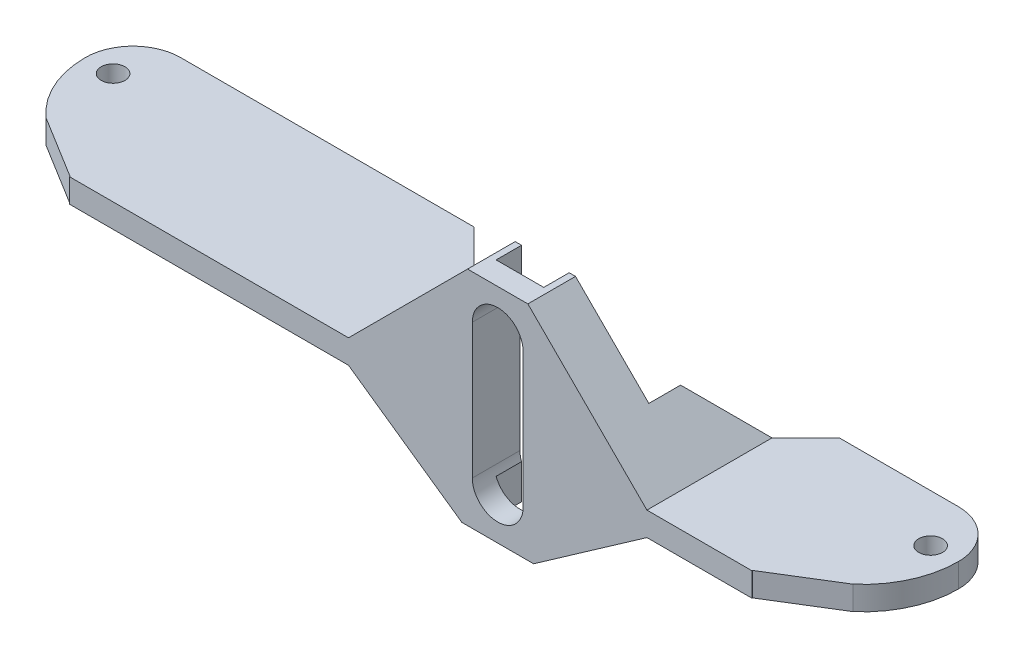
from build123d import *
from build123d.topology import SkipClean

# Parameters (mm, degrees)
BOSS_EXTRUDE1_DEPTH = 3
CUT_EXTRUDE1_DEPTH  = 10
CUT_EXTRUDE3_START  = 8
SKETCH8_W           = 6
SKETCH8_H           = 3
CUT_EXTRUDE3_DEPTH  = 6
BOSS_EXTRUDE4_START = 18
BOSS_EXTRUDE4_DEPTH = 28
BOSS_EXTRUDE5_DEPTH = 3
CUT_EXTRUDE4_DEPTH  = 3
CHAMFER1_SIZE       = 15
CHAMFER2_SIZE       = 15
CHAMFER2_SIZE_2     = 10.503113073
CUT_EXTRUDE5_DEPTH  = 10
CUT_EXTRUDE6_DEPTH  = 5
BOSS_EXTRUDE8_DEPTH = 2
CHAMFER3_DEPTH      = 4
CHAMFER3_2_DEPTH    = 3


with BuildPart() as part:
    # Sketch1 → Boss-Extrude1 (new body)
    with BuildSketch(Plane(origin=(0, 0, 0), x_dir=(1, 0, 0), z_dir=(0, 1, 0))):
        with BuildLine():
            ThreePointArc((-49, -6), (-53.242640687, -4.242640687), (-55, 0))
            ThreePointArc((-55, 0), (-51.485281374, -8.485281374), (-43, -12))
            Line((-43, -12), (43, -12))
            ThreePointArc((43, -12), (51.485281374, -8.485281374), (55, 0))
            ThreePointArc((55, 0), (53.242640687, -4.242640687), (49, -6))
            Line((49, -6), (-49, -6))
        make_face()
        with BuildLine():
            Line((-53, 0), (-55, 0))
            ThreePointArc((-55, 0), (-53.242640687, -4.242640687), (-49, -6))
            Line((-49, -6), (49, -6))
            ThreePointArc((49, -6), (53.242640687, -4.242640687), (55, 0))
            Line((55, 0), (53, 0))
            ThreePointArc((53, 0), (51.5, -1.5), (50, 0))
            Line((50, 0), (-50, 0))
            ThreePointArc((-50, 0), (-51.5, -1.5), (-53, 0))
        make_face()
        with BuildLine():
            Line((49, 6), (-49, 6))
            ThreePointArc((-49, 6), (-53.242640687, 4.242640687), (-55, 0))
            Line((-55, 0), (-53, 0))
            ThreePointArc((-53, 0), (-51.5, 1.5), (-50, 0))
            Line((-50, 0), (50, 0))
            ThreePointArc((50, 0), (51.5, 1.5), (53, 0))
            Line((53, 0), (55, 0))
            ThreePointArc((55, 0), (53.242640687, 4.242640687), (49, 6))
        make_face()
    extrude(amount=BOSS_EXTRUDE1_DEPTH)

    # Sketch2 → Cut-Extrude1 (cut)
    with BuildSketch(Plane(origin=(0, 3, 0), x_dir=(1, 0, 0), z_dir=(0, 1, 0))):
        Polygon((22, -8), (36, 6), (-14, 6), (0, -8), align=None)
    extrude(amount=-CUT_EXTRUDE1_DEPTH, mode=Mode.SUBTRACT)

    # Sketch8 → Cut-Extrude3 (cut)
    with BuildSketch(Plane.XY.offset(CUT_EXTRUDE3_START)):
        with Locations((10.960071178, 1.5)):
            Rectangle(SKETCH8_W, SKETCH8_H)
    extrude(amount=CUT_EXTRUDE3_DEPTH, mode=Mode.SUBTRACT)


with BuildPart() as cut_extrude3_piece_1:
    # of the separate pieces the step leaves, piece 1, a body of its own (cut_extrude3_pieces)
    add(part.part.solids().sort_by_distance((-55, 0, 0))[0])

    # Sketch9 → Boss-Extrude4 (add)
    with BuildSketch(Plane(origin=(0, 0, 0), x_dir=(1, 0, 0), z_dir=(0, 1, 0)).offset(BOSS_EXTRUDE4_START)):
        Polygon((13.960071178, -11.2), (13.960071178, -8), (14.760071178, -8), (14.760071178, -12), (7.160071178, -12), (7.160071178, -8), (7.960071178, -8), (7.960071178, -11.2), align=None)
    extrude(amount=-BOSS_EXTRUDE4_DEPTH)


with BuildPart() as cut_extrude3_piece_2:
    # of the separate pieces the step leaves, piece 2, a body of its own (cut_extrude3_pieces)
    add(part.part.solids().sort_by_distance((13.960071178, 0, 12))[0])


with BuildPart() as cut_extrude3_piece_1_1:
    add(cut_extrude3_piece_1.part)

    # Combine1: union Cut-Extrude3 piece 2
    add(cut_extrude3_piece_2.part)

    # Sketch11 → Boss-Extrude5 (add)
    with BuildSketch(Plane(origin=(0, 3, 0), x_dir=(1, 0, 0), z_dir=(0, 1, 0))):
        Polygon((-14, 6), (-12, 6), (2, -8), (0, -8), align=None)
        Polygon((20, -8), (34, 6), (36, 6), (22, -8), align=None)
    extrude(amount=-BOSS_EXTRUDE5_DEPTH)

    # Sketch13 → Cut-Extrude4 (cut)
    with BuildSketch(Plane(origin=(0, 3, 0), x_dir=(1, 0, 0), z_dir=(0, 1, 0))):
        Polygon((2, -8), (-2, -8), (-2, -4), align=None)
        Polygon((24, -4), (24, -8), (20, -8), align=None)
    extrude(amount=-CUT_EXTRUDE4_DEPTH, mode=Mode.SUBTRACT)

    # Chamfer1
    chamfer1_edges = [cut_extrude3_piece_1_1.edges().sort_by_distance(p)[0] for p in [
        (14.760071178, 3, 10),
        (7.160071178, 3, 10),
    ]]
    chamfer(chamfer1_edges, length=CHAMFER1_SIZE - 0.0001)  # a hair under: the kernel refuses the full size

    # Chamfer2
    # the kernel refuses this chamfer: 15, 10.503113073 mm, written as the material it adds along each edge
    with BuildSketch(Plane(origin=(7.160071178, 0, 12), x_dir=(-1, 0, 0), z_dir=(0, 0, -1))) as chamfer2_piece_1_section:
        Polygon((CHAMFER2_SIZE, 0), (0, -CHAMFER2_SIZE_2), (0, 0), align=None)
    chamfer2_piece_1 = extrude(amount=4, mode=Mode.PRIVATE)
    chamfer2_piece_1 = split(chamfer2_piece_1, bisect_by=Plane(origin=(-2, 0, 12), z_dir=(-1, 0, 0)), keep=Keep.TOP, mode=Mode.PRIVATE)
    add(chamfer2_piece_1)
    with BuildSketch(Plane(origin=(7.160071178, 0, 12), x_dir=(-1, 0, 0), z_dir=(0, 0, -1))) as chamfer2_piece_2_section:
        Polygon((CHAMFER2_SIZE, 0), (0, -CHAMFER2_SIZE_2), (0, 0), align=None)
    chamfer2_piece_2 = extrude(amount=4, mode=Mode.PRIVATE)
    chamfer2_piece_2 = split(chamfer2_piece_2, bisect_by=Plane(origin=(6.580035589, 0, 12.580035589), z_dir=(-0.7071067811865489, 0, 0.7071067811865461)), keep=Keep.TOP, mode=Mode.PRIVATE)
    chamfer2_piece_2 = split(chamfer2_piece_2, bisect_by=Plane(origin=(-2, 0, 12), z_dir=(1, 0, 0)), keep=Keep.TOP, mode=Mode.PRIVATE)
    add(chamfer2_piece_2)
    with BuildSketch(Plane(origin=(7.160071178, 0, 12), x_dir=(-1, 0, 0), z_dir=(0, 0, -1))) as chamfer2_piece_3_section:
        Polygon((CHAMFER2_SIZE, 0), (0, -CHAMFER2_SIZE_2), (0, 0), align=None)
    chamfer2_piece_3 = extrude(amount=42.738283454, mode=Mode.PRIVATE)
    chamfer2_piece_3 = split(chamfer2_piece_3, bisect_by=Plane(origin=(6.580035589, 0, 12.580035589), z_dir=(-0.7071067811865489, 0, 0.7071067811865461)), keep=Keep.TOP, mode=Mode.PRIVATE)
    chamfer2_piece_3 = split(chamfer2_piece_3, bisect_by=Plane(origin=(-2, 0, 12), z_dir=(-1, 0, 0)), keep=Keep.TOP, mode=Mode.PRIVATE)
    chamfer2_piece_3 = split(chamfer2_piece_3, bisect_by=Plane(origin=(7.160071178, 0, 8), z_dir=(0, 0, -1)), keep=Keep.TOP, mode=Mode.PRIVATE)
    add(chamfer2_piece_3)
    with BuildSketch(Plane(origin=(7.160071178, 0, 12), x_dir=(-1, 0, 0), z_dir=(0, 0, -1))) as chamfer2_piece_4_section:
        Polygon((CHAMFER2_SIZE, 0), (0, -CHAMFER2_SIZE_2), (0, 0), align=None)
    chamfer2_piece_4 = extrude(amount=4, mode=Mode.PRIVATE)
    chamfer2_piece_4 = split(chamfer2_piece_4, bisect_by=Plane(origin=(6.580035589, 0, 12.580035589), z_dir=(0.7071067811865489, 0, -0.7071067811865461)), keep=Keep.TOP, mode=Mode.PRIVATE)
    chamfer2_piece_4 = split(chamfer2_piece_4, bisect_by=Plane(origin=(7.160071178, -10, 12), z_dir=(0, 1, 0)), keep=Keep.TOP, mode=Mode.PRIVATE)
    add(chamfer2_piece_4)
    with BuildSketch(Plane(origin=(14.760071178, 0, 12), x_dir=(0, -1, 0), z_dir=(0, 0, -1))) as chamfer2_piece_5_section:
        Polygon((CHAMFER2_SIZE_2, 0), (0, -CHAMFER2_SIZE), (0, 0), align=None)
    chamfer2_piece_5 = extrude(amount=4, mode=Mode.PRIVATE)
    chamfer2_piece_5 = split(chamfer2_piece_5, bisect_by=Plane(origin=(15.380035589, 0, 12.619964411), z_dir=(0.7071067811865462, 0, 0.7071067811865489)), keep=Keep.TOP, mode=Mode.PRIVATE)
    chamfer2_piece_5 = split(chamfer2_piece_5, bisect_by=Plane(origin=(24, 0, 12), z_dir=(-1, 0, 0)), keep=Keep.TOP, mode=Mode.PRIVATE)
    add(chamfer2_piece_5)
    with BuildSketch(Plane(origin=(14.760071178, 0, 12), x_dir=(0, -1, 0), z_dir=(0, 0, -1))) as chamfer2_piece_6_section:
        Polygon((CHAMFER2_SIZE_2, 0), (0, -CHAMFER2_SIZE), (0, 0), align=None)
    chamfer2_piece_6 = extrude(amount=4, mode=Mode.PRIVATE)
    chamfer2_piece_6 = split(chamfer2_piece_6, bisect_by=Plane(origin=(24, 0, 12), z_dir=(1, 0, 0)), keep=Keep.TOP, mode=Mode.PRIVATE)
    add(chamfer2_piece_6)
    with BuildSketch(Plane(origin=(14.760071178, 0, 12), x_dir=(0, -1, 0), z_dir=(0, 0, -1))) as chamfer2_piece_7_section:
        Polygon((CHAMFER2_SIZE_2, 0), (0, -CHAMFER2_SIZE), (0, 0), align=None)
    chamfer2_piece_7 = extrude(amount=4, mode=Mode.PRIVATE)
    chamfer2_piece_7 = split(chamfer2_piece_7, bisect_by=Plane(origin=(14.760071178, -10, 12), z_dir=(0, 1, 0)), keep=Keep.TOP, mode=Mode.PRIVATE)
    chamfer2_piece_7 = split(chamfer2_piece_7, bisect_by=Plane(origin=(15.380035589, 0, 12.619964411), z_dir=(-0.7071067811865462, 0, -0.7071067811865489)), keep=Keep.TOP, mode=Mode.PRIVATE)
    add(chamfer2_piece_7)
    with BuildSketch(Plane(origin=(14.760071178, 0, 12), x_dir=(0, -1, 0), z_dir=(0, 0, -1))) as chamfer2_piece_8_section:
        Polygon((CHAMFER2_SIZE_2, 0), (0, -CHAMFER2_SIZE), (0, 0), align=None)
    chamfer2_piece_8 = extrude(amount=42.738283454, mode=Mode.PRIVATE)
    chamfer2_piece_8 = split(chamfer2_piece_8, bisect_by=Plane(origin=(14.760071178, 0, 8), z_dir=(0, 0, -1)), keep=Keep.TOP, mode=Mode.PRIVATE)
    chamfer2_piece_8 = split(chamfer2_piece_8, bisect_by=Plane(origin=(15.380035589, 0, 12.619964411), z_dir=(0.7071067811865462, 0, 0.7071067811865489)), keep=Keep.TOP, mode=Mode.PRIVATE)
    chamfer2_piece_8 = split(chamfer2_piece_8, bisect_by=Plane(origin=(24, 0, 12), z_dir=(1, 0, 0)), keep=Keep.TOP, mode=Mode.PRIVATE)
    add(chamfer2_piece_8)

    # Sketch15 → Cut-Extrude5 (cut)
    with BuildSketch(Plane.XY.offset(12)):
        with BuildLine():
            Line((14.160071178, 12.5), (14.160071178, -4.5))
            ThreePointArc((14.160071178, -4.5), (10.960071178, -7.7), (7.760071178, -4.5))
            Line((7.760071178, -4.5), (7.760071178, 12.5))
            ThreePointArc((7.760071178, 12.5), (10.960071178, 15.7), (14.160071178, 12.5))
        make_face()
    extrude(amount=-CUT_EXTRUDE5_DEPTH, mode=Mode.SUBTRACT)

    # Sketch16 → Cut-Extrude6 (cut)
    with BuildSketch(Plane(origin=(0, 0, 0), x_dir=(1, 0, 0), z_dir=(0, 1, 0))):
        Polygon((-7.839928822, 1.839928822), (-2, -4), (-2, -7.160071178), (-7.839928822, -7.160071178), align=None)
        Polygon((24, -7.160071178), (24, -4), (29.760071178, 1.760071178), (29.760071178, -7.160071178), align=None)
    extrude(amount=-CUT_EXTRUDE6_DEPTH, mode=Mode.SUBTRACT)

    # Sketch17 → Boss-Extrude8 (add)
    with SkipClean():  # the faces are left unmerged after this step: merging them gives an invalid solid
        with BuildSketch(Plane.XY.offset(12)):
            Polygon((-7.839928822, 0), (6.441551245, -10), (15.47859111, -10), (29.760071178, 0), (43, 0), (43, 3), (29.760071178, 3), (14.760071178, 18), (7.160071178, 18), (-7.839928822, 3), (-43, 3), (-43, 0), align=None)
            with BuildLine():
                Line((7.760071178, -4.5), (7.760071178, 12.5))
                ThreePointArc((7.760071178, 12.5), (10.960071178, 15.7), (14.160071178, 12.5))
                Line((14.160071178, 12.5), (14.160071178, -4.5))
                ThreePointArc((14.160071178, -4.5), (10.960071178, -7.7), (7.760071178, -4.5))
            make_face(mode=Mode.SUBTRACT)
        extrude(amount=BOSS_EXTRUDE8_DEPTH)

    # Chamfer3: read off the stored shape, not the designer's step
    # Chamfer3 outline → Chamfer3 (cut)
    with SkipClean():  # the faces are left unmerged after this step: merging them gives an invalid solid
        with BuildSketch(Plane(origin=(0, 0, 0), x_dir=(1, 0, 0), z_dir=(0, 1, 0))):
            with BuildLine():
                ThreePointArc((47.608318931, -11.079864468), (49.300429772, -10.212961602), (50.834384089, -9.08968789))
                Line((50.834384089, -9.08968789), (47.608318931, -11.079864468))
            make_face()
            with BuildLine():
                ThreePointArc((-50.834384089, -9.08968789), (-49.300429772, -10.212961602), (-47.608318931, -11.079864468))
                Line((-47.608318931, -11.079864468), (-50.834384089, -9.08968789))
            make_face()
        extrude(amount=CHAMFER3_DEPTH, mode=Mode.SUBTRACT)

    # Chamfer3 2 outline → Chamfer3 2 (add)
    with SkipClean():  # the faces are left unmerged after this step: merging them gives an invalid solid
        with BuildSketch(Plane(origin=(0, 0, 0), x_dir=(1, 0, 0), z_dir=(0, 1, 0))):
            with BuildLine():
                Line((43, -13.922760673), (47.608318931, -11.079864468))
                ThreePointArc((47.608318931, -11.079864468), (45.349641077, -11.767717995), (43, -12))
                Line((43, -12), (43, -13.922760673))
            make_face()
            with BuildLine():
                Line((-47.608318931, -11.079864468), (-43, -13.922760673))
                Line((-43, -13.922760673), (-43, -12))
                ThreePointArc((-43, -12), (-45.349641077, -11.767717995), (-47.608318931, -11.079864468))
            make_face()
        extrude(amount=CHAMFER3_2_DEPTH)


solid = cut_extrude3_piece_1_1.part
